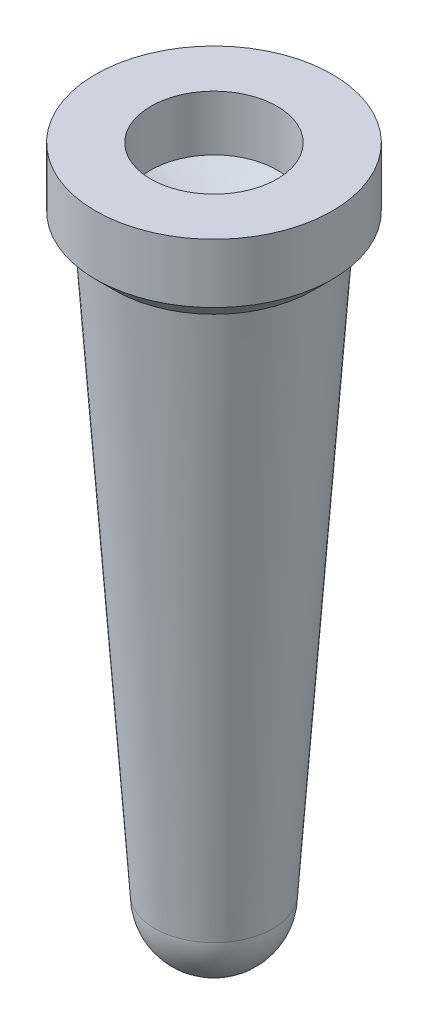
from build123d import *

# Parameters (mm, degrees)
SKETCH1_R           = 0.381
BOSS_EXTRUDE1_DEPTH = 0.254
CHAMFER1_SIZE       = 0.0635
SKETCH5_R           = 0.2032
CUT_EXTRUDE1_DEPTH  = 0.254
CHAMFER2_SIZE       = 0.0762


with BuildPart() as part:
    # Sketch1 → Boss-Extrude1 (new body)
    with BuildSketch(Plane(origin=(0, 0, 0), x_dir=(1, 0, 0), z_dir=(0, 1, 0))):
        with Locations(Location((0, 0, 0), (0, 0, 270))):
            Circle(SKETCH1_R)
    extrude(amount=BOSS_EXTRUDE1_DEPTH)

    # Chamfer1
    chamfer1_edges = [part.edges().sort_by_distance(p)[0] for p in [
        (0, 0, -0.381),
    ]]
    chamfer(chamfer1_edges, length=CHAMFER1_SIZE)

    # Sketch4 → Revolve1 (revolve)
    with BuildSketch(Plane.ZY):
        with BuildLine():
            Line((0, 0), (0, -2.032))
            ThreePointArc((0, -2.032), (0.134703842, -1.976203842), (0.1905, -1.8415))
            Line((0.1905, -1.8415), (0.3175, 0))
            Line((0.3175, 0), (0, 0))
        make_face()
    revolve(axis=Axis((0, 0.254, 0), (0, -1, 0)))

    # Sketch5 → Cut-Extrude1 (cut)
    with BuildSketch(Plane(origin=(0, 0.254, 0), x_dir=(1, 0, 0), z_dir=(0, 1, 0))):
        with Locations(Location((0, 0, 0), (0, 0, 270))):
            Circle(SKETCH5_R)
    extrude(amount=-CUT_EXTRUDE1_DEPTH, mode=Mode.SUBTRACT)

    # Chamfer2
    # the kernel refuses this chamfer: 0.203200488, 0.0762 mm, written as the material it adds along each edge
    with BuildSketch(Plane(origin=(0, 0, 0), x_dir=(0, 0, 1), z_dir=(-1, 0, 0))) as chamfer2_piece_1:
        Polygon((0.2032, CHAMFER2_SIZE), (0, 1.83e-07), (0, 0), (0.2032, 0), align=None)
    revolve(axis=Axis((0, 0, 0), (0, 1, 0)))


solid = part.part
